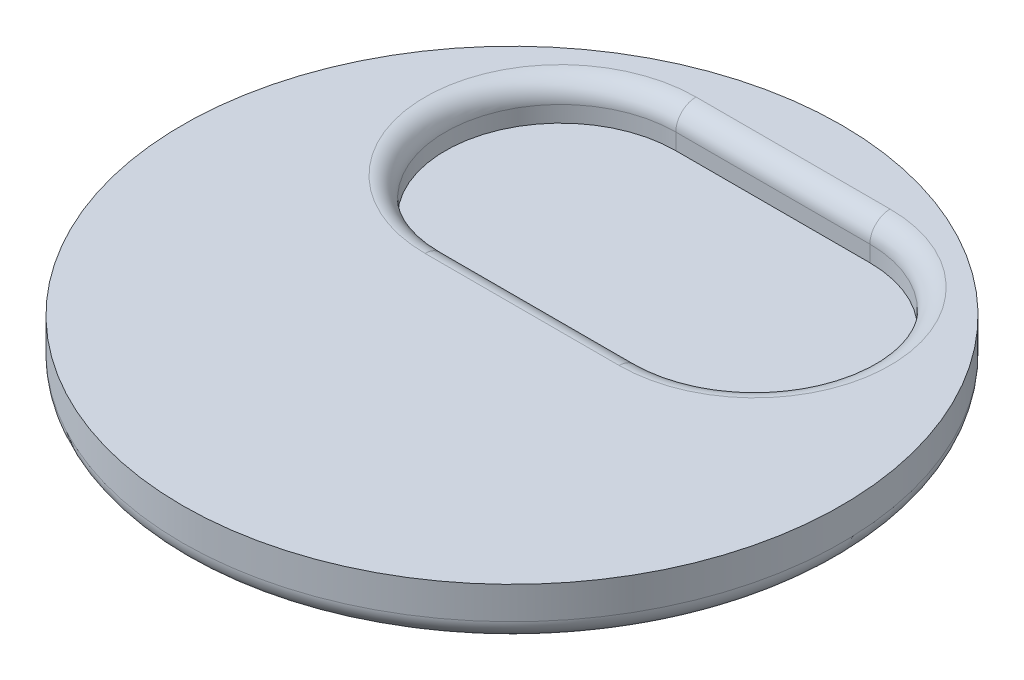
from build123d import *

# Parameters (mm, degrees)
SKETCH1_R           = 8.15
BOSS_EXTRUDE1_DEPTH = 1.3
BOSS_EXTRUDE2_DEPTH = 0.4
FILLET3_R           = 0.5
FILLET4_R           = 0.5


with BuildPart() as part:
    # Sketch1 → Boss-Extrude1 (new body)
    with BuildSketch(Plane(origin=(0, 0, 0), x_dir=(1, 0, 0), z_dir=(0, 1, 0))):
        Circle(SKETCH1_R)
        with BuildLine():
            ThreePointArc((-2.4, 0.75), (-5.25, 3.6), (-2.4, 6.45))
            Line((-2.4, 6.45), (2.4, 6.45))
            ThreePointArc((2.4, 6.45), (4.415254326, 5.615254326), (5.25, 3.6))
            ThreePointArc((5.25, 3.6), (4.415254326, 1.584745674), (2.4, 0.75))
            Line((2.4, 0.75), (-2.4, 0.75))
        make_face(mode=Mode.SUBTRACT)
    extrude(amount=BOSS_EXTRUDE1_DEPTH)

    # Sketch1<4> → Boss-Extrude2 (add)
    with BuildSketch(Plane(origin=(0, 0, 0), x_dir=(1, 0, 0), z_dir=(0, 1, 0))):
        with BuildLine():
            ThreePointArc((-2.4, 6.45), (-5.25, 3.6), (-2.4, 0.75))
            Line((-2.4, 0.75), (2.4, 0.75))
            ThreePointArc((2.4, 0.75), (5.25, 3.6), (2.4, 6.45))
            Line((2.4, 6.45), (-2.4, 6.45))
        make_face()
    extrude(amount=BOSS_EXTRUDE2_DEPTH)

    # Fillet3
    fillet3_edges = [part.edges().sort_by_distance(p)[0] for p in [
        (5.25, 1.3, -3.6),
        (-5.25, 1.3, -3.6),
        (0, 1.3, -6.45),
        (0, 1.3, -0.75),
    ]]
    fillet(fillet3_edges, radius=FILLET3_R)

    # Fillet4
    fillet4_edges = [part.edges().sort_by_distance(p)[0] for p in [
        (-8.15, 0, 0),
    ]]
    fillet(fillet4_edges, radius=FILLET4_R)


solid = part.part
